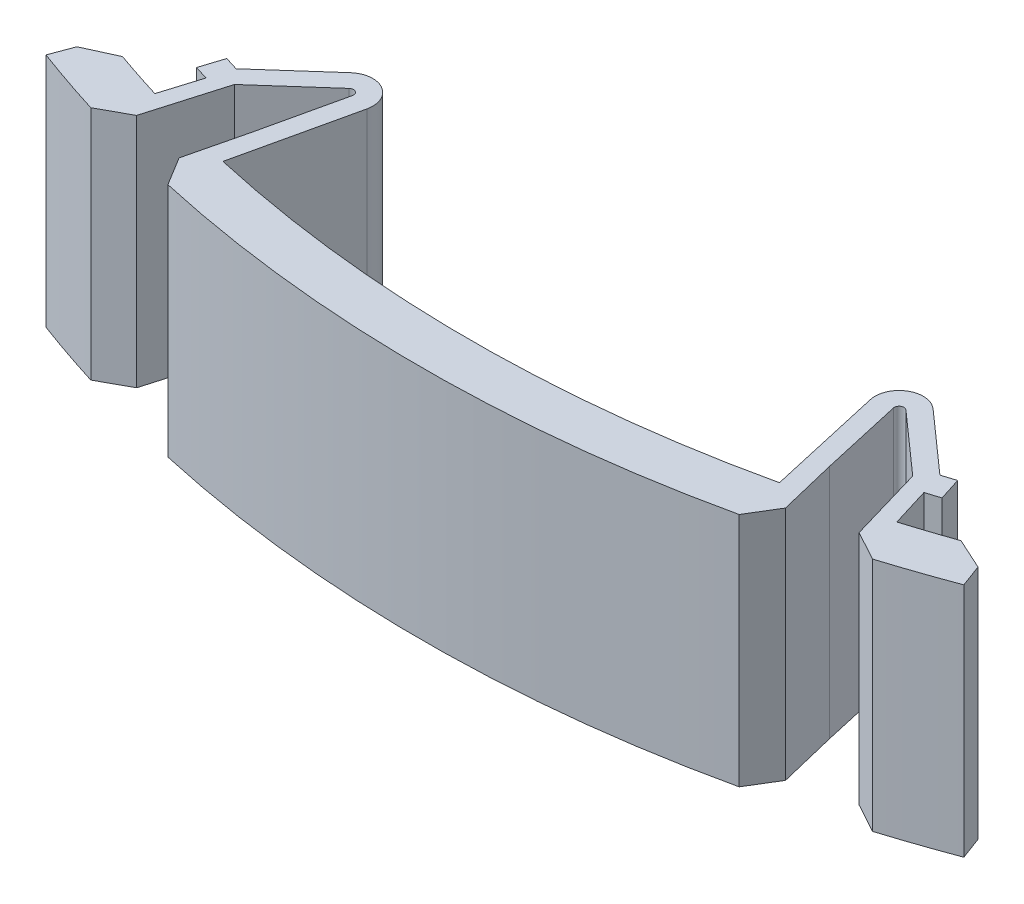
from build123d import *

# Parameters (mm, degrees)
EXTRUDE_1_DEPTH = 4.9
CHAMFER_1_SIZE  = 1


with BuildPart() as part:
    # Эскиз2 → Бобышка-Вытянуть1 (new, symmetric)
    with BuildSketch(Plane(origin=(0, 0, 0), x_dir=(1, 0, 0), z_dir=(0, 1, 0))):
        with BuildLine():
            Line((-19.066440629, -51.056055877), (-18.366754734, -49.182439148))
            ThreePointArc((-18.366754734, -49.182439148), (-16.897260285, -49.706464317), (-15.412844037, -50.186594213))
            Line((-15.412844037, -50.186594213), (-14.972477064, -48.752691521))
            Line((-14.972477064, -48.752691521), (-14.913761468, -48.561504496))
            ThreePointArc((-14.913761468, -48.561504496), (-15.200281945, -48.472584301), (-15.486272306, -48.381973607))
            Line((-15.486272306, -48.381973607), (-15.181424426, -47.429572551))
            Line((-15.181424426, -47.429572551), (-14.620183486, -47.605569368))
            Line((-14.620183486, -47.605569368), (-12.098110765, -45.366305195))
            ThreePointArc((-12.098110765, -45.366305195), (-10.925741151, -45.252992376), (-10.458715596, -46.334277464))
            Line((-10.458715596, -46.334277464), (-11.229357798, -49.748382119))
            Line((-11.229357798, -49.748382119), (-11.559633028, -51.211569828))
            ThreePointArc((-11.559633028, -51.211569828), (0, -52.5), (11.559633028, -51.211569828))
            Line((11.559633028, -51.211569828), (11.229357798, -49.748382119))
            Line((11.229357798, -49.748382119), (10.458715596, -46.334277464))
            ThreePointArc((10.458715596, -46.334277464), (10.925741151, -45.252992376), (12.098110765, -45.366305195))
            Line((12.098110765, -45.366305195), (14.620183486, -47.605569368))
            Line((14.620183486, -47.605569368), (15.181424426, -47.429572551))
            Line((15.181424426, -47.429572551), (15.486272306, -48.381973607))
            ThreePointArc((15.486272306, -48.381973607), (15.200281945, -48.472584301), (14.913761468, -48.561504496))
            Line((14.913761468, -48.561504496), (14.972477064, -48.752691521))
            Line((14.972477064, -48.752691521), (15.412844037, -50.186594213))
            ThreePointArc((15.412844037, -50.186594213), (16.897260285, -49.706464317), (18.366754734, -49.182439148))
            Line((18.366754734, -49.182439148), (19.066440629, -51.056055877))
            ThreePointArc((19.066440629, -51.056055877), (17.189479987, -51.718195809), (15.289593803, -52.311359391))
            Line((15.289593803, -52.311359391), (14.089034129, -48.203800394))
            Line((14.089034129, -48.203800394), (11.566961408, -45.964536221))
            ThreePointArc((11.566961408, -45.964536221), (11.332487486, -45.941873657), (11.239082375, -46.158130675))
            Line((11.239082375, -46.158130675), (12.009724576, -49.57223533))
            Line((12.009724576, -49.57223533), (12.8323427, -52.967735281))
            ThreePointArc((12.8323427, -52.967735281), (0, -54.5), (-12.8323427, -52.967735281))
            Line((-12.8323427, -52.967735281), (-12.009724576, -49.57223533))
            Line((-12.009724576, -49.57223533), (-11.239082375, -46.158130675))
            ThreePointArc((-11.239082375, -46.158130675), (-11.332487486, -45.941873657), (-11.566961408, -45.964536221))
            Line((-11.566961408, -45.964536221), (-14.089034129, -48.203800394))
            Line((-14.089034129, -48.203800394), (-15.289593803, -52.311359391))
            ThreePointArc((-15.289593803, -52.311359391), (-17.189479987, -51.718195809), (-19.066440629, -51.056055877))
        make_face()
    extrude(amount=EXTRUDE_1_DEPTH, both=True)

    # Фаска1
    # the kernel refuses this chamfer: 1 mm, written as the material it takes off along each edge
    with BuildSketch(Plane(origin=(-18.366754734, 7.496724976, 49.182439148), x_dir=(0.9401293921516592, 0, 0.3408177313646573), z_dir=(0, -1, 0))) as chamfer_1_piece_1:
        with BuildLine():
            Line((1.009757262, 0), (-CHAMFER_1_SIZE * 0.00961673582767, CHAMFER_1_SIZE * 0.999953758127))
            Line((-CHAMFER_1_SIZE * 0.00961673582767, CHAMFER_1_SIZE * 0.999953758127), (0, 0))
            ThreePointArc((0, 0), (0.519160584, 0.002425756), (1.009757262, 0))
        make_face()
    extrude(amount=14.993449951, mode=Mode.SUBTRACT)
    with BuildSketch(Plane(origin=(18.366754734, 7.496724976, 49.182439148), x_dir=(0.34984294732251126, 0, 0.9368083647196467), z_dir=(0, -1, 0))) as chamfer_1_piece_2:
        with BuildLine():
            Line((CHAMFER_1_SIZE, 0), (-0.009710569, 1.009710569))
            ThreePointArc((-0.009710569, 1.009710569), (-0.002566987, 0.519159905), (0, 0))
            Line((0, 0), (CHAMFER_1_SIZE, 0))
        make_face()
    extrude(amount=14.993449951, mode=Mode.SUBTRACT)
    with BuildSketch(Plane(origin=(15.289593803, 7.471682988, 52.311359391), x_dir=(-0.2805430055685125, 0, -0.9598414567138605), z_dir=(0, -1, 0))) as chamfer_1_piece_3:
        with BuildLine():
            Line((CHAMFER_1_SIZE, 0), (0.009010472, 0.990989528))
            ThreePointArc((0.009010472, 0.990989528), (0.002381843, 0.509524531), (0, 0))
            Line((0, 0), (CHAMFER_1_SIZE, 0))
        make_face()
    extrude(amount=14.943365976, mode=Mode.SUBTRACT)
    with BuildSketch(Plane(origin=(12.8323427, 7.471682988, 52.967735281), x_dir=(-0.9739856496022864, 0, 0.22660969610502585), z_dir=(0, -1, 0)), Plane(origin=(-15.289593803, 7.471682988, 52.311359391), x_dir=(-0.9572510798876259, 0, -0.2892583102591421), z_dir=(0, -1, 0))) as chamfer_1_piece_4:
        with BuildLine():
            Line((0.991030491, 0), (CHAMFER_1_SIZE * 0.00909202285035, CHAMFER_1_SIZE * 0.999958666706))
            Line((CHAMFER_1_SIZE * 0.00909202285035, CHAMFER_1_SIZE * 0.999958666706), (0, 0))
            ThreePointArc((0, 0), (0.509525126, -0.002250864), (0.991030491, 0))
        make_face()
    extrude(amount=14.943365976, mode=Mode.SUBTRACT)
    with BuildSketch(Plane(origin=(-12.8323427, -7.471682988, 52.967735281), x_dir=(0.23545582936194254, 0, -0.9718850510320034), z_dir=(0, 1, 0))) as chamfer_1_piece_5:
        with BuildLine():
            Line((CHAMFER_1_SIZE, 0), (0.009010472, -0.990989528))
            ThreePointArc((0.009010472, -0.990989528), (0.002381843, -0.509524531), (0, 0))
            Line((0, 0), (CHAMFER_1_SIZE, 0))
        make_face()
    extrude(amount=14.943365976, mode=Mode.SUBTRACT)


solid = part.part
